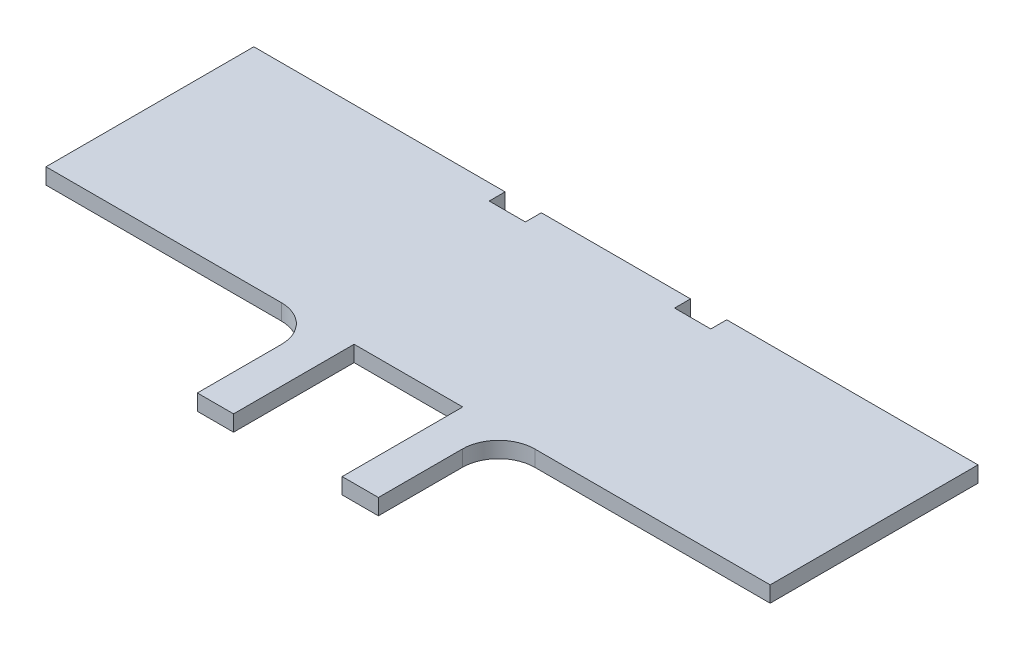
from build123d import *

# Parameters (mm, degrees)
BOSS_EXTRUDE1_DEPTH = 5.588


with BuildPart() as part:
    # Sketch1 → Boss-Extrude1 (new body)
    with BuildSketch(Plane(origin=(0, 0, 0), x_dir=(1, 0, 0), z_dir=(0, 1, 0))):
        with BuildLine():
            Line((-127, -40.925201107), (-127, 31.972798893))
            Line((-127, 31.972798893), (-38.862, 31.972798893))
            Line((-38.862, 31.972798893), (-38.862, 26.384798893))
            Line((-38.862, 26.384798893), (-26.162, 26.384798893))
            Line((-26.162, 26.384798893), (-26.162, 31.972798893))
            Line((-26.162, 31.972798893), (26.162, 31.972798893))
            Line((26.162, 31.972798893), (26.162, 26.384798893))
            Line((26.162, 26.384798893), (38.862, 26.384798893))
            Line((38.862, 26.384798893), (38.862, 31.972798893))
            Line((38.862, 31.972798893), (127, 31.972798893))
            Line((127, 31.972798893), (127, -40.925201107))
            Line((127, -40.925201107), (44.45, -40.925201107))
            ThreePointArc((44.45, -40.925201107), (35.469743879, -44.644944986), (31.75, -53.625201107))
            Line((31.75, -53.625201107), (31.75, -83.089201107))
            Line((31.75, -83.089201107), (19.05, -83.089201107))
            Line((19.05, -83.089201107), (19.05, -40.802434469))
            Line((19.05, -40.802434469), (0, -40.802434469))
            Line((0, -40.802434469), (-19.05, -40.802434469))
            Line((-19.05, -40.802434469), (-19.05, -83.089201107))
            Line((-19.05, -83.089201107), (-31.75, -83.089201107))
            Line((-31.75, -83.089201107), (-31.75, -53.625201107))
            ThreePointArc((-31.75, -53.625201107), (-35.469743879, -44.644944986), (-44.45, -40.925201107))
            Line((-44.45, -40.925201107), (-127, -40.925201107))
        make_face()
    extrude(amount=BOSS_EXTRUDE1_DEPTH)


solid = part.part
